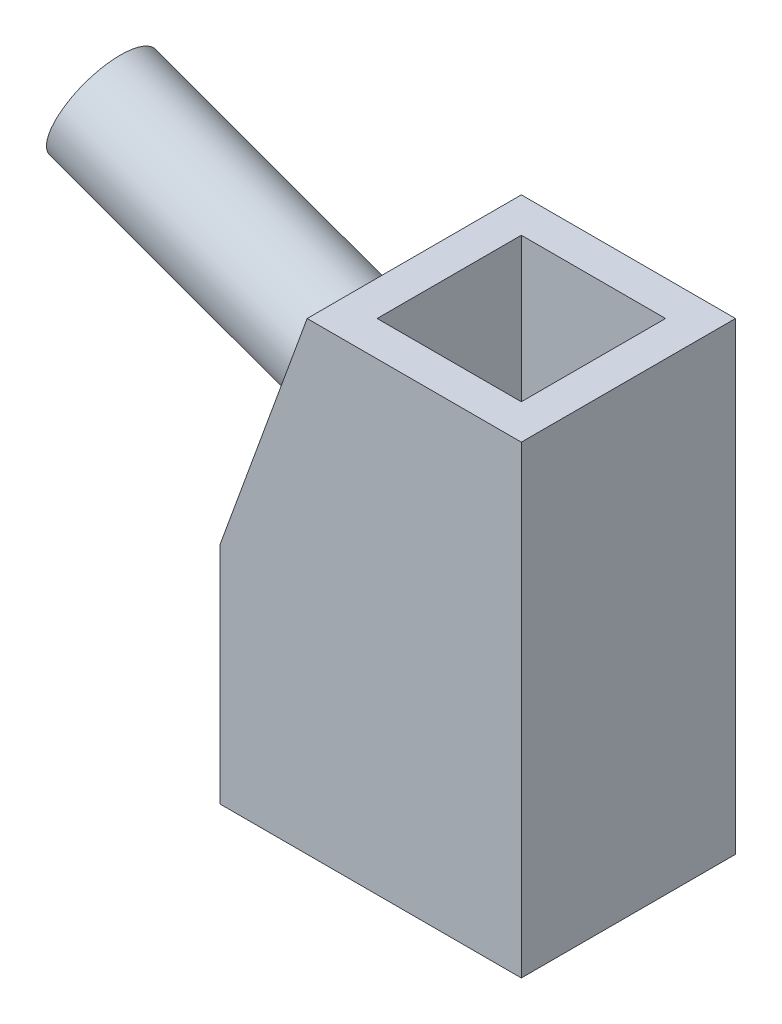
from build123d import *

# Parameters (mm, degrees)
SKETCH1_W           = 53.594
SKETCH1_H           = 38.1
BOSS_EXTRUDE1_DEPTH = 82.55
CUT_EXTRUDE1_DEPTH  = 106.538757506
SKETCH5_W           = 25.654
SKETCH5_H           = 25.654
CUT_EXTRUDE2_DEPTH  = 106.538757506
SKETCH6_R           = 9.4107
BOSS_EXTRUDE2_DEPTH = 50.8


with BuildPart() as part:
    # Sketch1 → Boss-Extrude1 (new body)
    with BuildSketch(Plane(origin=(0, 0, 0), x_dir=(1, 0, 0), z_dir=(0, 1, 0))):
        with Locations((26.797, 19.05)):
            Rectangle(SKETCH1_W, SKETCH1_H)
    extrude(amount=BOSS_EXTRUDE1_DEPTH)

    # Sketch4 → Cut-Extrude1 (cut, through all)
    with BuildSketch(Plane.XY):
        Polygon((0, 39.980584863), (15.494, 82.55), (0, 82.55), align=None)
    extrude(amount=-CUT_EXTRUDE1_DEPTH, mode=Mode.SUBTRACT)

    # Sketch5 → Cut-Extrude2 (cut, through all)
    with BuildSketch(Plane(origin=(0, 82.55, 0), x_dir=(1, 0, 0), z_dir=(0, 1, 0))):
        with Locations((34.544, 19.05)):
            Rectangle(SKETCH5_W, SKETCH5_H)
    extrude(amount=-CUT_EXTRUDE2_DEPTH, mode=Mode.SUBTRACT)

    # Sketch6 → Boss-Extrude2 (add)
    with BuildSketch(Plane(origin=(-12.849512289, 4.676839998, 0), x_dir=(0, 0, 1), z_dir=(-0.9396926207859096, 0.3420201433256656, 0))):
        with Locations((-19.05, 60.220173259)):
            Circle(SKETCH6_R)
    extrude(amount=BOSS_EXTRUDE2_DEPTH)


solid = part.part
